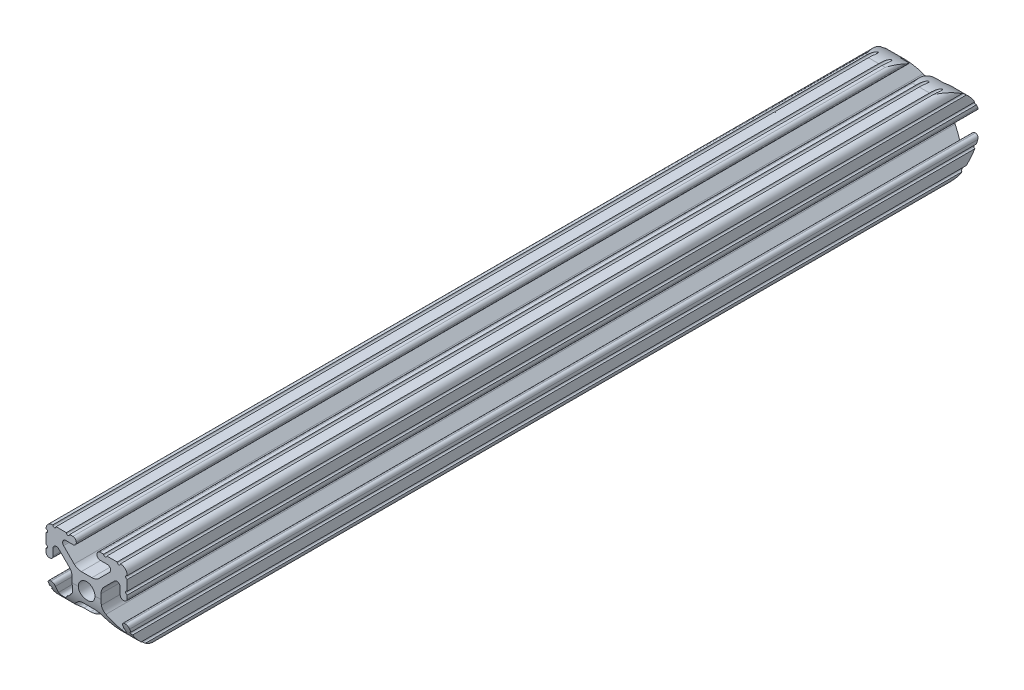
from build123d import *

# Parameters (mm, degrees)
SKETCH1_R               = 2.6035
BOSS_EXTRUDE1_DEPTH     = 133.35
CUT_EXTRUDE1_DEPTH      = 136.054229746
CUT_EXTRUDE1_DEPTH_BACK = 136.054229746
SKETCH2_R               = 3.175
CUT_EXTRUDE2_DEPTH      = 136.054229867
CUT_EXTRUDE2_DEPTH_BACK = 136.054229867


with BuildPart() as part:
    # Sketch1 → Boss-Extrude1 (new, symmetric)
    with BuildSketch(Plane.XY):
        with BuildLine():
            Line((-7.179650497, -8.645192506), (-3.952270251, -5.423690499))
            ThreePointArc((-3.952270251, -5.423690499), (-2.922936451, -4.736929036), (-1.709253557, -4.4958))
            Line((-1.709253557, -4.4958), (1.709253557, -4.4958))
            ThreePointArc((1.709253557, -4.4958), (2.922936451, -4.736929036), (3.952270251, -5.423690499))
            Line((3.952270251, -5.423690499), (7.179650497, -8.645192506))
            ThreePointArc((7.179650497, -8.645192506), (7.41473083, -9.822813117), (6.416408329, -10.4902))
            Line((6.416408329, -10.4902), (4.287512407, -10.4902))
            ThreePointArc((4.287512407, -10.4902), (3.54574862, -10.79744862), (3.2385, -11.539212407))
            Line((3.2385, -11.539212407), (3.2385, -11.650987593))
            ThreePointArc((3.2385, -11.650987593), (3.54574862, -12.39275138), (4.287512407, -12.7))
            Line((4.287512407, -12.7), (5.317126718, -12.7))
            ThreePointArc((5.317126718, -12.7), (5.825126718, -12.192), (6.333126718, -12.7))
            Line((6.333126718, -12.7), (9.550443118, -12.7))
            ThreePointArc((9.550443118, -12.7), (10.058366869, -12.192000006), (10.566443095, -12.699847501))
            ThreePointArc((10.566443095, -12.699847501), (12.082537762, -12.08250727), (12.699846982, -10.566399977))
            ThreePointArc((12.699846982, -10.566399977), (12.192000006, -10.058323491), (12.7, -9.5504))
            Line((12.7, -9.5504), (12.7, -6.3330836))
            ThreePointArc((12.7, -6.3330836), (12.192, -5.8250836), (12.7, -5.3170836))
            Line((12.7, -5.3170836), (12.7, -4.287469289))
            ThreePointArc((12.7, -4.287469289), (12.39275138, -3.545705502), (11.650987593, -3.238456882))
            Line((11.650987593, -3.238456882), (11.539212407, -3.238456882))
            ThreePointArc((11.539212407, -3.238456882), (10.79744862, -3.545705502), (10.4902, -4.287469289))
            Line((10.4902, -4.287469289), (10.4902, -6.402089023))
            ThreePointArc((10.4902, -6.402089023), (9.856505071, -7.351067942), (8.737131347, -7.129408934))
            Line((8.737131347, -7.129408934), (5.441005833, -3.840816462))
            ThreePointArc((5.441005833, -3.840816462), (4.750877967, -2.809883091), (4.5085, -1.593185507))
            Line((4.5085, -1.593185507), (4.5085, 1.593185507))
            ThreePointArc((4.5085, 1.593185507), (4.750877967, 2.809883091), (5.441005833, 3.840816462))
            Line((5.441005833, 3.840816462), (8.737131347, 7.129408934))
            ThreePointArc((8.737131347, 7.129408934), (9.856505071, 7.351067942), (10.4902, 6.402089023))
            Line((10.4902, 6.402089023), (10.4902, 4.287469289))
            ThreePointArc((10.4902, 4.287469289), (10.79744862, 3.545705502), (11.539212407, 3.238456882))
            Line((11.539212407, 3.238456882), (11.650987593, 3.238456882))
            ThreePointArc((11.650987593, 3.238456882), (12.39275138, 3.545705502), (12.7, 4.287469289))
            Line((12.7, 4.287469289), (12.7, 5.3170836))
            ThreePointArc((12.7, 5.3170836), (12.192, 5.8250836), (12.7, 6.3330836))
            Line((12.7, 6.3330836), (12.7, 9.5504))
            ThreePointArc((12.7, 9.5504), (12.192000006, 10.058323491), (12.699846982, 10.566399977))
            ThreePointArc((12.699846982, 10.566399977), (12.082537762, 12.08250727), (10.566443095, 12.699847501))
            ThreePointArc((10.566443095, 12.699847501), (10.058366869, 12.192000006), (9.550443118, 12.7))
            Line((9.550443118, 12.7), (6.333126718, 12.7))
            ThreePointArc((6.333126718, 12.7), (5.825126718, 12.192), (5.317126718, 12.7))
            Line((5.317126718, 12.7), (4.287512407, 12.7))
            ThreePointArc((4.287512407, 12.7), (3.54574862, 12.39275138), (3.2385, 11.650987593))
            Line((3.2385, 11.650987593), (3.2385, 11.539212407))
            ThreePointArc((3.2385, 11.539212407), (3.54574862, 10.79744862), (4.287512407, 10.4902))
            Line((4.287512407, 10.4902), (6.476788598, 10.4902))
            ThreePointArc((6.476788598, 10.4902), (7.432222385, 9.85140422), (7.207036008, 8.724370562))
            Line((7.207036008, 8.724370562), (3.898272566, 5.423169045))
            ThreePointArc((3.898272566, 5.423169045), (2.869120213, 4.736787962), (1.655778399, 4.4958))
            Line((1.655778399, 4.4958), (-1.655778399, 4.4958))
            ThreePointArc((-1.655778399, 4.4958), (-2.869120213, 4.736787962), (-3.898272566, 5.423169045))
            Line((-3.898272566, 5.423169045), (-7.207036008, 8.724370562))
            ThreePointArc((-7.207036008, 8.724370562), (-7.432222385, 9.85140422), (-6.476788598, 10.4902))
            Line((-6.476788598, 10.4902), (-4.287512407, 10.4902))
            ThreePointArc((-4.287512407, 10.4902), (-3.54574862, 10.79744862), (-3.2385, 11.539212407))
            Line((-3.2385, 11.539212407), (-3.2385, 11.650987593))
            ThreePointArc((-3.2385, 11.650987593), (-3.54574862, 12.39275138), (-4.287512407, 12.7))
            Line((-4.287512407, 12.7), (-5.317126718, 12.7))
            ThreePointArc((-5.317126718, 12.7), (-5.825126718, 12.192), (-6.333126718, 12.7))
            Line((-6.333126718, 12.7), (-9.550443118, 12.7))
            ThreePointArc((-9.550443118, 12.7), (-10.058366869, 12.192000006), (-10.566443095, 12.699847501))
            ThreePointArc((-10.566443095, 12.699847501), (-12.082537762, 12.08250727), (-12.699846982, 10.566399977))
            ThreePointArc((-12.699846982, 10.566399977), (-12.192000006, 10.058323491), (-12.7, 9.5504))
            Line((-12.7, 9.5504), (-12.7, 6.3330836))
            ThreePointArc((-12.7, 6.3330836), (-12.192, 5.8250836), (-12.7, 5.3170836))
            Line((-12.7, 5.3170836), (-12.7, 4.287469289))
            ThreePointArc((-12.7, 4.287469289), (-12.39275138, 3.545705502), (-11.650987593, 3.238456882))
            Line((-11.650987593, 3.238456882), (-11.539212407, 3.238456882))
            ThreePointArc((-11.539212407, 3.238456882), (-10.79744862, 3.545705502), (-10.4902, 4.287469289))
            Line((-10.4902, 4.287469289), (-10.4902, 6.402089023))
            ThreePointArc((-10.4902, 6.402089023), (-9.856505071, 7.351067942), (-8.737131347, 7.129408934))
            Line((-8.737131347, 7.129408934), (-5.441005833, 3.840816462))
            ThreePointArc((-5.441005833, 3.840816462), (-4.750877967, 2.809883091), (-4.5085, 1.593185507))
            Line((-4.5085, 1.593185507), (-4.5085, -1.593185507))
            ThreePointArc((-4.5085, -1.593185507), (-4.750877967, -2.809883091), (-5.441005833, -3.840816462))
            Line((-5.441005833, -3.840816462), (-8.737131347, -7.129408934))
            ThreePointArc((-8.737131347, -7.129408934), (-9.856505071, -7.351067942), (-10.4902, -6.402089023))
            Line((-10.4902, -6.402089023), (-10.4902, -4.287469289))
            ThreePointArc((-10.4902, -4.287469289), (-10.79744862, -3.545705502), (-11.539212407, -3.238456882))
            Line((-11.539212407, -3.238456882), (-11.650987593, -3.238456882))
            ThreePointArc((-11.650987593, -3.238456882), (-12.39275138, -3.545705502), (-12.7, -4.287469289))
            Line((-12.7, -4.287469289), (-12.7, -5.3170836))
            ThreePointArc((-12.7, -5.3170836), (-12.192, -5.8250836), (-12.7, -6.3330836))
            Line((-12.7, -6.3330836), (-12.7, -9.5504))
            ThreePointArc((-12.7, -9.5504), (-12.192000006, -10.058323491), (-12.699846982, -10.566399977))
            ThreePointArc((-12.699846982, -10.566399977), (-12.082537762, -12.08250727), (-10.566443095, -12.699847501))
            ThreePointArc((-10.566443095, -12.699847501), (-10.058366869, -12.192000006), (-9.550443118, -12.7))
            Line((-9.550443118, -12.7), (-6.333126718, -12.7))
            ThreePointArc((-6.333126718, -12.7), (-5.825126718, -12.192), (-5.317126718, -12.7))
            Line((-5.317126718, -12.7), (-4.287512407, -12.7))
            ThreePointArc((-4.287512407, -12.7), (-3.54574862, -12.39275138), (-3.2385, -11.650987593))
            Line((-3.2385, -11.650987593), (-3.2385, -11.539212407))
            ThreePointArc((-3.2385, -11.539212407), (-3.54574862, -10.79744862), (-4.287512407, -10.4902))
            Line((-4.287512407, -10.4902), (-6.416408329, -10.4902))
            ThreePointArc((-6.416408329, -10.4902), (-7.41473083, -9.822813117), (-7.179650497, -8.645192506))
        make_face()
        Circle(SKETCH1_R, mode=Mode.SUBTRACT)
    extrude(amount=BOSS_EXTRUDE1_DEPTH, both=True)

    # Sketch2 → Cut-Extrude1 (cut, two sides: drawn at the far end of the back side and taken through both)
    with BuildSketch(Plane(origin=(4.5085, 0, 0), x_dir=(0, 0, -1), z_dir=(1, 0, 0)).offset(-CUT_EXTRUDE1_DEPTH_BACK)):
        with Locations((-120.65, 0)):
            Circle(SKETCH2_R)
        with Locations((-95.25, 0)):
            Circle(SKETCH2_R)
        with BuildLine():
            Line((-133.35, 0), (-133.35, -12.7))
            Line((-133.35, -12.7), (-120.65, -12.7))
            ThreePointArc((-120.65, -12.7), (-129.630256121, -8.980256121), (-133.35, 0))
        make_face()
    extrude(amount=CUT_EXTRUDE1_DEPTH + CUT_EXTRUDE1_DEPTH_BACK, mode=Mode.SUBTRACT)

    # Sketch3 → Cut-Extrude2 (cut, two sides: drawn at the far end of the back side and taken through both)
    with BuildSketch(Plane(origin=(4.5085, 0, 0), x_dir=(0, 0, -1), z_dir=(1, 0, 0)).offset(-CUT_EXTRUDE2_DEPTH_BACK)):
        with BuildLine():
            Line((133.35, 12.7), (120.65, 12.7))
            ThreePointArc((120.65, 12.7), (129.048111218, 9.52689498), (133.249673009, 1.593185507))
            Line((133.249673009, 1.593185507), (133.35, 1.593185507))
            Line((133.35, 1.593185507), (133.35, 12.7))
        make_face()
        with BuildLine():
            Line((133.35, -12.7), (133.35, -1.593185507))
            Line((133.35, -1.593185507), (133.249673009, -1.593185507))
            ThreePointArc((133.249673009, -1.593185507), (129.048111218, -9.52689498), (120.65, -12.7))
            Line((120.65, -12.7), (133.35, -12.7))
        make_face()
    extrude(amount=CUT_EXTRUDE2_DEPTH + CUT_EXTRUDE2_DEPTH_BACK, mode=Mode.SUBTRACT)


solid = part.part
